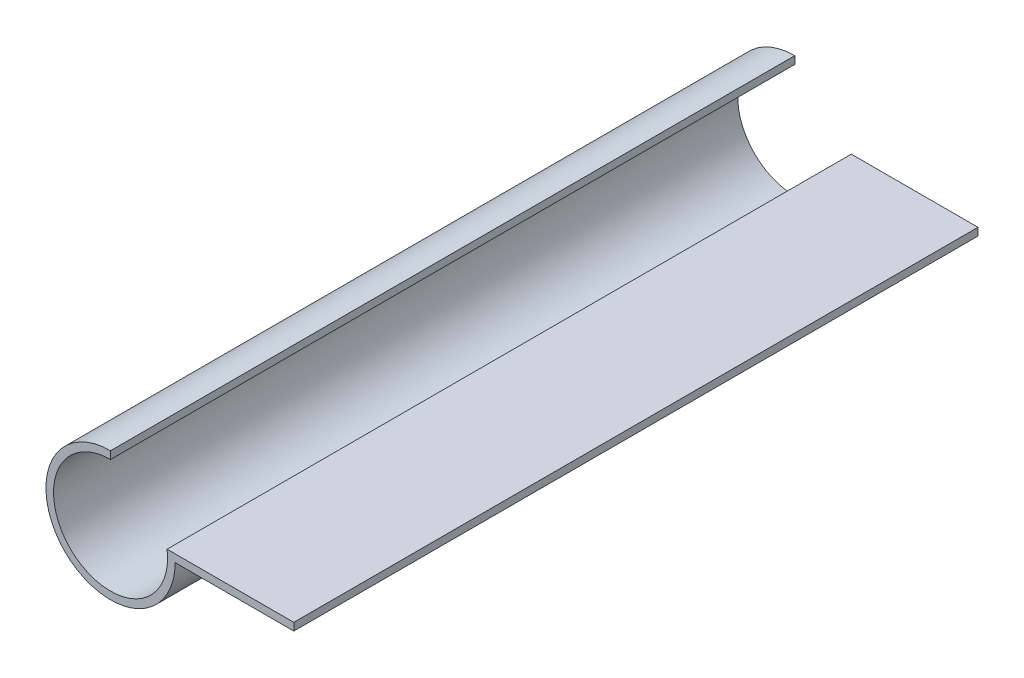
from build123d import *

# Parameters (mm, degrees)
BOSS_EXTRUDE1_DEPTH = 27


with BuildPart() as part:
    # Sketch1 → Boss-Extrude1 (new body)
    with BuildSketch(Plane.XY):
        with BuildLine():
            Line((7.229910312, 0), (2.55, 0))
            ThreePointArc((2.55, 0), (-1.803122292, -1.803122292), (0, 2.55))
            Line((0, 2.55), (0, 2.25))
            ThreePointArc((0, 2.25), (-1.481131324, -1.693738469), (2.229910312, 0.3))
            Line((2.229910312, 0.3), (7.229910312, 0.3))
            Line((7.229910312, 0.3), (7.229910312, 0))
        make_face()
    extrude(amount=BOSS_EXTRUDE1_DEPTH)


solid = part.part
